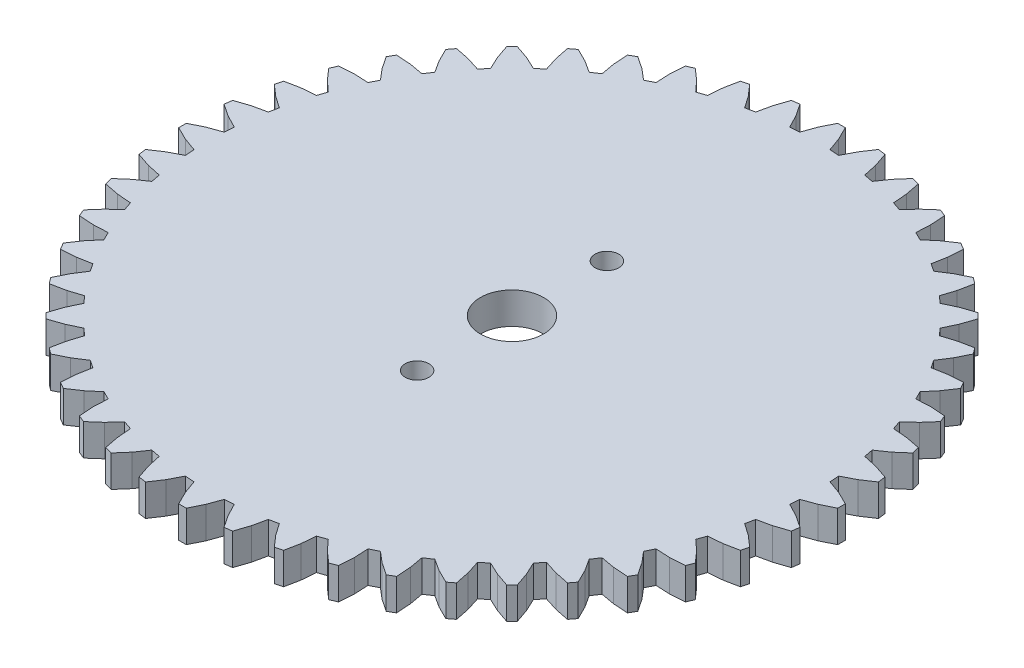
from build123d import *

# Parameters (mm, degrees)
BOSS_EXTRUDE2_DEPTH = 4
CUT_EXTRUDE1_REACH  = 67.976
SKETCH3_R           = 4
CUT_EXTRUDE2_REACH  = 67.976
SKETCH4_R           = 1.5


with BuildPart() as part:
    # Sketch1 → Boss-Extrude2 (new body)
    with BuildSketch(Plane(origin=(0, 0, 0), x_dir=(1, 0, 0), z_dir=(0, 1, 0))):
        Polygon((42.670768214, 7.33199203), (44.364090179, 6.722783745), (46.049296244, 5.897590381), (46.049296244, 4.930501415), (44.364090179, 4.10530805), (42.670768214, 3.496099765), (42.593668553, 2.318392566), (44.192872884, 1.493330462), (45.756080243, 0.455162666), (45.629761993, -0.503548343), (43.851224003, -1.101761341), (42.092976227, -1.484774504), (41.862723156, -2.64232275), (43.340583693, -3.668971144), (44.754826389, -4.902310618), (44.504546088, -5.836412796), (42.663045168, -6.197303661), (40.869846795, -6.347576757), (40.490498727, -7.465069617), (41.821751264, -8.676025199), (43.062944581, -10.083330557), (42.692890512, -10.976722901), (40.819973758, -11.094271266), (39.022455841, -11.009186038), (38.500557723, -12.067643121), (39.662294716, -13.441830895), (40.709232397, -14.999147756), (40.225688377, -15.836645304), (38.353556868, -15.7087561), (36.582480794, -15.389753168), (35.926802973, -16.37097933), (36.899389583, -17.885098897), (37.734007744, -19.56572336), (37.14535034, -20.332928251), (35.305944489, -19.96169562), (33.591678325, -19.414272165), (32.813478148, -20.30164275), (33.58002859, -21.929645586), (34.188189572, -23.704910872), (33.504368159, -24.388732285), (31.729102873, -23.780570839), (30.101100501, -23.01402086), (29.213729452, -23.792221038), (29.761152907, -25.506486738), (30.132385538, -27.345893053), (29.365180648, -27.934549993), (27.684556184, -27.099932296), (26.170436617, -26.127345222), (25.189210455, -26.783023506), (25.508213387, -28.554099581), (25.636103055, -30.426230626), (24.798605043, -30.90977511), (23.241288182, -29.862837428), (21.867100409, -28.701100436), (20.808643325, -29.222998554), (20.893728553, -31.020516471), (20.776180188, -32.893433225), (19.882787844, -33.263487293), (18.475482486, -32.022293977), (17.264527368, -30.69104144), (16.147034045, -31.070389508), (15.996760948, -32.863587881), (15.635870083, -34.705088337), (14.701767905, -34.955369102), (13.468428431, -33.541125942), (12.441780037, -32.063265869), (11.284231792, -32.293518476), (10.901218628, -34.051766716), (10.30300563, -35.830304706), (9.344294621, -35.956622956), (8.306126825, -34.393415597), (7.481064721, -32.794210802), (6.303357522, -32.871310927), (5.694149237, -34.564632892), (4.868955873, -36.249838957), (3.901866906, -36.249838957), (3.076674006, -34.564632892), (2.467465257, -32.871310927), (1.289758521, -32.794210802), (0.464695954, -34.393415597), (-0.573471379, -35.956622956), (-1.532182851, -35.830304706), (-2.130395385, -34.051766716), (-2.513408549, -32.293518476), (-3.670957258, -32.063265869), (-4.697605189, -33.541125942), (-5.930944663, -34.955369102), (-6.865046841, -34.705088337), (-7.22593817, -32.863587881), (-7.376211266, -31.070389508), (-8.493704125, -30.69104144), (-9.704659707, -32.022293977), (-11.111965066, -33.263487293), (-12.005356946, -32.893433225), (-12.122905311, -31.020516471), (-12.037820547, -29.222998554), (-13.096277166, -28.701100436), (-14.470464939, -29.862837428), (-16.0277818, -30.90977511), (-16.865279812, -30.426230626), (-16.737390608, -28.554099581), (-16.418387213, -26.783023506), (-17.399613375, -26.127345222), (-18.913732941, -27.099932296), (-20.594357869, -27.934549993), (-21.361562296, -27.345893053), (-20.990330128, -25.506486738), (-20.442906209, -23.792221038), (-21.330277258, -23.01402086), (-22.958280095, -23.780570839), (-24.733544916, -24.388732285), (-25.41736633, -23.704910872), (-24.809205347, -21.929645586), (-24.042655369, -20.30164275), (-24.820855546, -19.414272165), (-26.535121247, -19.96169562), (-28.374527561, -20.332928251), (-28.963184502, -19.56572336), (-28.128566341, -17.885098897), (-27.155979731, -16.37097933), (-27.811657551, -15.389753168), (-29.582734089, -15.7087561), (-31.454865135, -15.836645304), (-31.938409618, -14.999147756), (-30.891471473, -13.441830895), (-29.72973448, -12.067643121), (-30.251632599, -11.009186038), (-32.049150979, -11.094271266), (-33.92206727, -10.976722901), (-34.292121802, -10.083330557), (-33.050928022, -8.676025199), (-31.719675485, -7.465069617), (-32.099023553, -6.347576757), (-33.89222239, -6.197303661), (-35.733722846, -5.836412796), (-35.98400361, -4.902310618), (-34.569760451, -3.668971144), (-33.091899913, -2.64232275), (-33.322152985, -1.484774504), (-35.080401224, -1.101761341), (-36.858938751, -0.503548343), (-36.985257465, 0.455162666), (-35.422050106, 1.493330462), (-33.822845311, 2.318392566), (-33.899945435, 3.496099765), (-35.593266937, 4.10530805), (-37.278473002, 4.930501415), (-37.278473002, 5.897590381), (-35.593266937, 6.722783745), (-33.899945435, 7.33199203), (-33.822845311, 8.509698766), (-35.422050106, 9.334761333), (-36.985257465, 10.372928666), (-36.858938751, 11.331640138), (-35.080401224, 11.929852672), (-33.322152985, 12.3128663), (-33.091899913, 13.470414546), (-34.569760451, 14.49706294), (-35.98400361, 15.73040195), (-35.733722846, 16.664504128), (-33.89222239, 17.025395457), (-32.099023553, 17.175668553), (-31.719675485, 18.293161413), (-33.050928022, 19.504116994), (-34.292121802, 20.911422353), (-33.92206727, 21.804814697), (-32.049150979, 21.922362598), (-30.251632599, 21.837277834), (-29.72973448, 22.895734917), (-30.891471473, 24.269922226), (-31.938409618, 25.827239088), (-31.454865135, 26.664737099), (-29.582734089, 26.536847895), (-27.811657551, 26.2178445), (-27.155979731, 27.199070662), (-28.128566341, 28.713190692), (-28.963184502, 30.393815156), (-28.374527561, 31.161019583), (-26.535121247, 30.789787415), (-24.820855546, 30.24236396), (-24.042655369, 31.129734545), (-24.809205347, 32.757737382), (-25.41736633, 34.533002667), (-24.733544916, 35.216823617), (-22.958280095, 34.608662635), (-21.330277258, 33.842112656), (-20.442906209, 34.620312834), (-20.990330128, 36.334578534), (-21.361562296, 38.173984848), (-20.594357869, 38.762641789), (-18.913732941, 37.928023628), (-17.399613375, 36.955437018), (-16.418387213, 37.611114838), (-16.737390608, 39.382191376), (-16.865279812, 41.254322422), (-16.0277818, 41.737866905), (-14.470464939, 40.690929224), (-13.096277166, 39.529191768), (-12.037820547, 40.051089886), (-12.122905311, 41.848608266), (-12.005356946, 43.721524557), (-11.111965066, 44.091579089), (-9.704659707, 42.850385772), (-8.493704125, 41.519133236), (-7.376211266, 41.898481304), (-7.22593817, 43.691679677), (-6.865046841, 45.533180133), (-5.930944663, 45.783460897), (-4.697605189, 44.369217738), (-3.670957258, 42.891357201), (-2.513408549, 43.121610272), (-2.130395385, 44.879858512), (-1.532182851, 46.658396038), (-0.573471379, 46.784714752), (0.464695954, 45.221507393), (1.289758521, 43.622302598), (2.467465257, 43.699402722), (3.076674006, 45.392724688), (3.901866906, 47.077930289), (4.868955873, 47.077930289), (5.694149237, 45.392724688), (6.303357522, 43.699402722), (7.481064721, 43.622302598), (8.306126825, 45.221507393), (9.344294621, 46.784714752), (10.30300563, 46.658396038), (10.901218628, 44.879858512), (11.284231792, 43.121610272), (12.441780037, 42.891357201), (13.468428431, 44.369217738), (14.701767905, 45.783460897), (15.635870083, 45.533180133), (15.996760948, 43.691679677), (16.147034045, 41.898481304), (17.264527368, 41.519133236), (18.475482486, 42.850385772), (19.882787844, 44.091579089), (20.776180188, 43.721524557), (20.893728553, 41.848608266), (20.808643325, 40.051089886), (21.867100409, 39.529191768), (23.241288182, 40.690929224), (24.798605043, 41.737866905), (25.636103055, 41.254322422), (25.508213387, 39.382191376), (25.189210455, 37.611114838), (26.170436617, 36.955437018), (27.684556184, 37.928023628), (29.365180648, 38.762641789), (30.132385538, 38.173984848), (29.761152907, 36.334578534), (29.213729452, 34.620312834), (30.101100501, 33.842112656), (31.729102873, 34.608662635), (33.504368159, 35.216823617), (34.188189572, 34.533002667), (33.58002859, 32.757737382), (32.813478148, 31.129734545), (33.591678325, 30.24236396), (35.305944489, 30.789787415), (37.14535034, 31.161019583), (37.734007744, 30.393815156), (36.899389583, 28.713190692), (35.926802973, 27.199070662), (36.582480794, 26.2178445), (38.353556868, 26.536847895), (40.225688377, 26.664737099), (40.709232397, 25.827239088), (39.662294716, 24.269922226), (38.500557723, 22.895734917), (39.022455841, 21.837277834), (40.819973758, 21.922362598), (42.692890512, 21.804814697), (43.062944581, 20.911422353), (41.821751264, 19.504116994), (40.490498727, 18.293161413), (40.869846795, 17.175668553), (42.663045168, 17.025395457), (44.504546088, 16.664504128), (44.754826389, 15.73040195), (43.340583693, 14.49706294), (41.862723156, 13.470414546), (42.092976227, 12.3128663), (43.851224003, 11.929852672), (45.629761993, 11.331640138), (45.756080243, 10.372928666), (44.192872884, 9.334761333), (42.593668553, 8.509698766), align=None)
    extrude(amount=BOSS_EXTRUDE2_DEPTH)

    # Sketch3 → Cut-Extrude1 (cut, up to next)
    with BuildSketch(Plane(origin=(0, 0, 0), x_dir=(1, 0, 0), z_dir=(0, 1, 0)), mode=Mode.PRIVATE) as cut_extrude1_sk1:
        with Locations((4.385411621, 5.414045898)):
            Circle(SKETCH3_R)
    cut_extrude1_tool1 = extrude(cut_extrude1_sk1.sketch, amount=CUT_EXTRUDE1_REACH, mode=Mode.PRIVATE) & part.part
    add(cut_extrude1_tool1.solids().sort_by_distance((4.385412, 0, -5.414046))[0], mode=Mode.SUBTRACT)

    # Sketch4 → Cut-Extrude2 (cut, up to next)
    with BuildSketch(Plane(origin=(0, 0, 0), x_dir=(1, 0, 0), z_dir=(0, 1, 0)), mode=Mode.PRIVATE) as cut_extrude2_sk1:
        with Locations((4.385411389, 17.414045898)):
            Circle(SKETCH4_R)
    cut_extrude2_tool1 = extrude(cut_extrude2_sk1.sketch, amount=CUT_EXTRUDE2_REACH, mode=Mode.PRIVATE) & part.part
    # Sketch4 → Cut-Extrude2 (cut, up to next)
    with BuildSketch(Plane(origin=(0, 0, 0), x_dir=(1, 0, 0), z_dir=(0, 1, 0)), mode=Mode.PRIVATE) as cut_extrude2_sk2:
        with Locations((4.385411389, -6.585954102)):
            Circle(SKETCH4_R)
    cut_extrude2_tool2 = extrude(cut_extrude2_sk2.sketch, amount=CUT_EXTRUDE2_REACH, mode=Mode.PRIVATE) & part.part
    add(cut_extrude2_tool1.solids().sort_by_distance((4.385411, 0, -17.414046))[0], mode=Mode.SUBTRACT)
    add(cut_extrude2_tool2.solids().sort_by_distance((4.385411, 0, 6.585954))[0], mode=Mode.SUBTRACT)


solid = part.part
